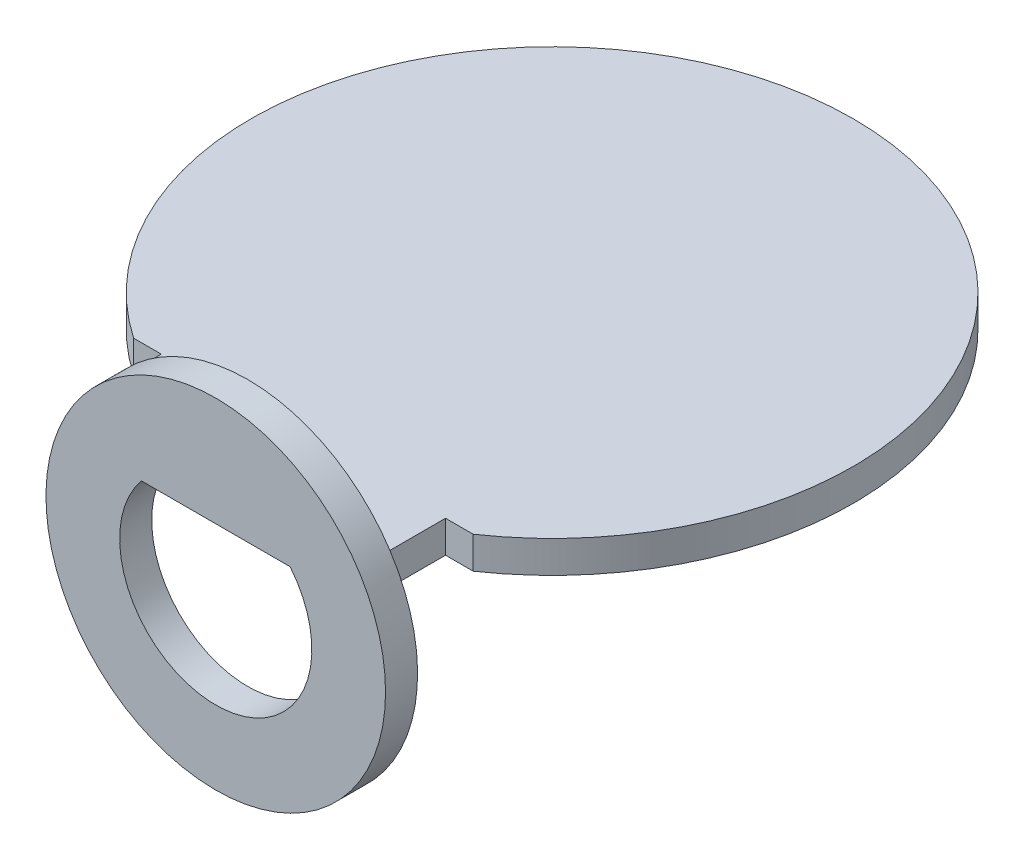
from build123d import *

# Parameters (mm, degrees)
SKETCH_1_R          = 26.5
EXTRUDE_1_DEPTH     = 5
EXTRUDE_2_DEPTH     = 5
SKETCH_3_W          = 4.318926987
SKETCH_3_H          = 5
CUT_EXTRUDE_1_DEPTH = 8.68


with BuildPart() as part:
    # 草图1 → 凸台-拉伸1 (new body)
    with BuildSketch(Plane.XY):
        Circle(SKETCH_1_R)
        with BuildLine():
            Line((0, 9.5), (-11.608186766, 9.5))
            ThreePointArc((-11.608186766, 9.5), (0, -15), (11.608186766, 9.5))
            Line((11.608186766, 9.5), (0, 9.5))
        make_face(mode=Mode.SUBTRACT)
    extrude(amount=EXTRUDE_1_DEPTH)

    # 草图2 → 凸台-拉伸2 (add)
    with BuildSketch(Plane(origin=(0, 9.5, 0), x_dir=(-1, 0, 0), z_dir=(0, -1, 0))):
        with BuildLine():
            Line((-26.5, 0), (26.5, 0))
            Line((26.5, 0), (26.5, 8.683122228))
            ThreePointArc((26.5, 8.683122228), (0, 94.5), (-26.5, 8.683122228))
            Line((-26.5, 8.683122228), (-26.5, 0))
        make_face()
    extrude(amount=-EXTRUDE_2_DEPTH)

    # 草图3 → 切除-拉伸1 (cut)
    with BuildSketch(Plane.XY):
        with Locations((24.340536507, 12)):
            Rectangle(SKETCH_3_W, SKETCH_3_H)
        with Locations((-24.340536507, 12)):
            Rectangle(SKETCH_3_W, SKETCH_3_H)
    extrude(amount=-CUT_EXTRUDE_1_DEPTH, mode=Mode.SUBTRACT)


solid = part.part
